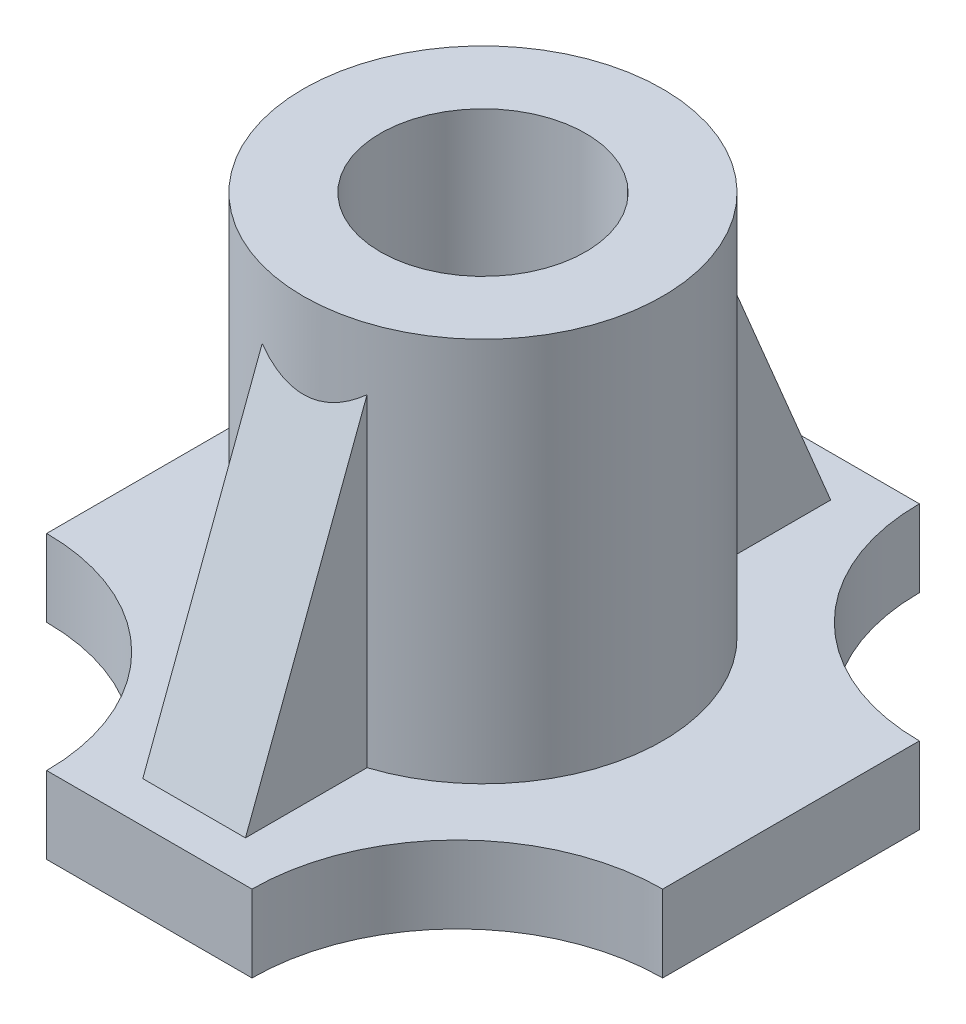
from build123d import *

# Parameters (mm, degrees)
SKETCH1_W           = 120
SKETCH1_H           = 130
BOSS_EXTRUDE1_DEPTH = 15
SKETCH2_R           = 40
CUT_EXTRUDE1_DEPTH  = 15
SKETCH3_R           = 35
SKETCH3_R_2         = 20
BOSS_EXTRUDE2_DEPTH = 75
BOSS_EXTRUDE4_DEPTH = 10
BOSS_EXTRUDE7_DEPTH = 10


with BuildPart() as part:
    # Sketch1 → Boss-Extrude1 (new body)
    with BuildSketch(Plane(origin=(0, 0, 0), x_dir=(1, 0, 0), z_dir=(0, 1, 0))):
        with Locations((-27.727272727, 65)):
            Rectangle(SKETCH1_W, SKETCH1_H)
    extrude(amount=-BOSS_EXTRUDE1_DEPTH)

    # Sketch2 → Cut-Extrude1 (cut)
    with BuildSketch(Plane(origin=(0, 0, 0), x_dir=(1, 0, 0), z_dir=(0, 1, 0))):
        with Locations((32.272727273, 0)):
            Circle(SKETCH2_R)
        with Locations((-87.727272727, 0)):
            Circle(SKETCH2_R)
        with Locations((-87.727272727, 130)):
            Circle(SKETCH2_R)
        with Locations((32.272727273, 130)):
            Circle(SKETCH2_R)
    extrude(amount=-CUT_EXTRUDE1_DEPTH, mode=Mode.SUBTRACT)

    # Sketch3 → Boss-Extrude2 (add)
    with BuildSketch(Plane(origin=(0, 0, 0), x_dir=(1, 0, 0), z_dir=(0, 1, 0))):
        with Locations((-27.727272727, 65)):
            Circle(SKETCH3_R)
        with Locations((-27.727272727, 65)):
            Circle(SKETCH3_R_2, mode=Mode.SUBTRACT)
    extrude(amount=BOSS_EXTRUDE2_DEPTH)


with BuildPart() as part_1:
    # Body-Move/Copy4: moved
    add(part.part.moved(Location((27, 0, 0))))

    # Sketch11 → Boss-Extrude4 (add, symmetric)
    with BuildSketch(Plane(origin=(0, 0, 0), x_dir=(0, 0, -1), z_dir=(1, 0, 0))):
        Polygon((31.658416133, 0), (31.658416133, 62.851266457), (8, 0), (30.095357037, 0), align=None)
    extrude(amount=BOSS_EXTRUDE4_DEPTH, both=True)

    # Sketch16 → Boss-Extrude7 (add, symmetric)
    with BuildSketch(Plane(origin=(0, 0, 0), x_dir=(0, 0, -1), z_dir=(1, 0, 0))):
        Polygon((96.940676982, 0), (122, 0), (96.940676982, 60), align=None)
    extrude(amount=BOSS_EXTRUDE7_DEPTH, both=True)


solid = part_1.part
